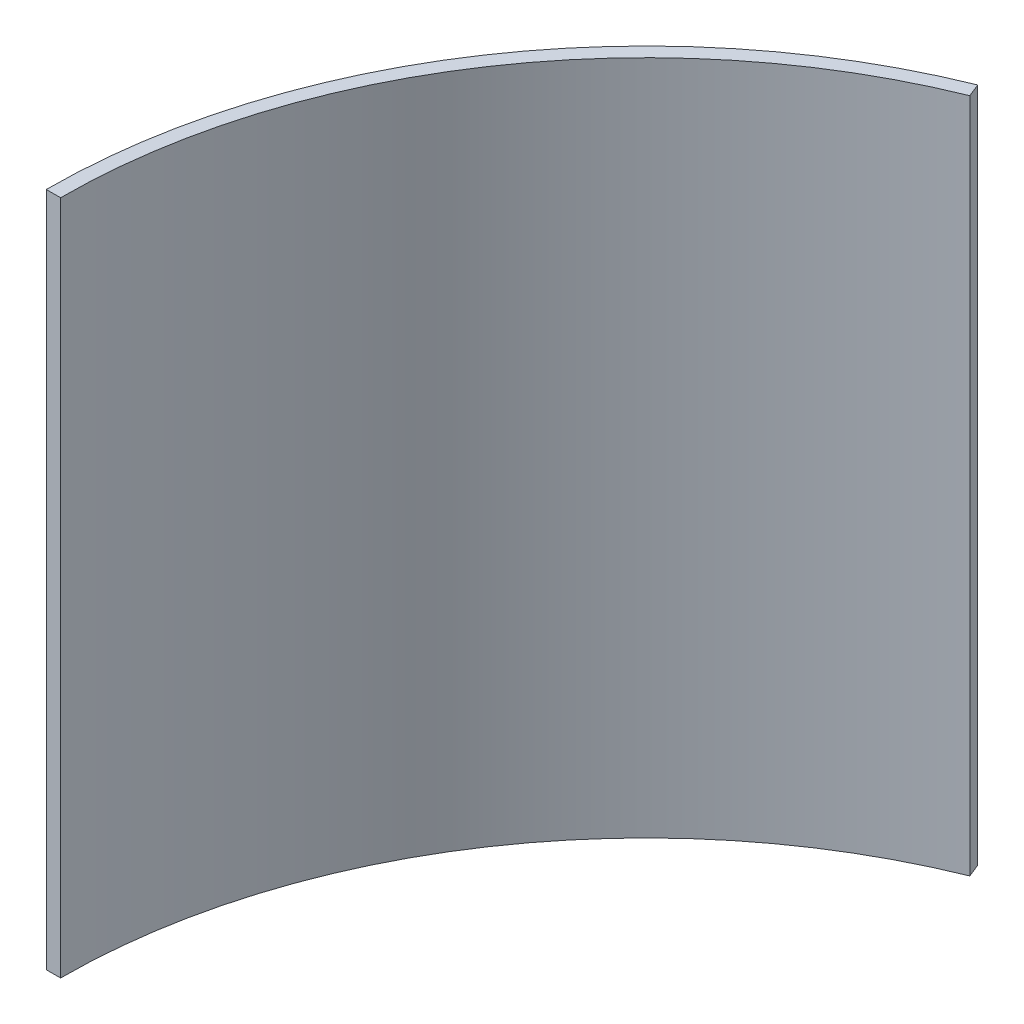
from build123d import *

# Parameters (mm, degrees)
BOSS_EXTRUDE1_DEPTH = 150


with BuildPart() as part:
    # Sketch1 → Boss-Extrude1 (new body)
    with BuildSketch(Plane(origin=(0, 0, 0), x_dir=(1, 0, 0), z_dir=(0, 1, 0))):
        with BuildLine():
            Line((-130, 0), (-133.175, 0))
            ThreePointArc((-133.175, 0), (-110.407078725, 74.47051492), (-49.888233078, 123.477709832))
            Line((-49.888233078, 123.477709832), (-48.698857144, 120.533901094))
            ThreePointArc((-48.698857144, 120.533901094), (-107.774884432, 72.695077451), (-130, 0))
        make_face()
    extrude(amount=BOSS_EXTRUDE1_DEPTH)


solid = part.part
